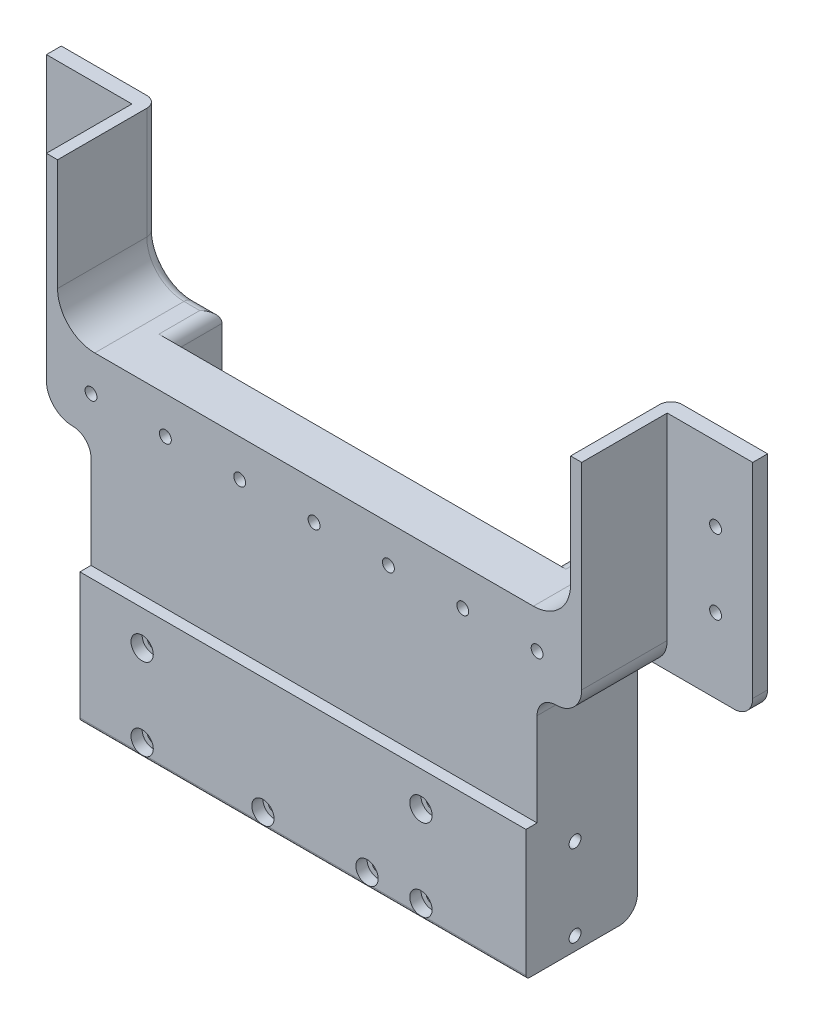
from build123d import *

# Parameters (mm, degrees)
SKETCH_1_W                  = 150
SKETCH_1_H                  = 20
EXTRUDE_1_DEPTH             = 20
SKETCH_2_W                  = 60
SKETCH_2_H                  = 65
EXTRUDE_2_DEPTH             = 5
SKETCH_3_R                  = 1.6
CUT_EXTRUDE_1_DEPTH         = 25
SKETCH_4_W                  = 51.75
SKETCH_4_H                  = 7
CUT_EXTRUDE_2_DEPTH         = 27
SKETCH_5_R                  = 1.6
CUT_EXTRUDE_3_DEPTH         = 27
SKETCH_6_W                  = 103.5
SKETCH_6_H                  = 35
EXTRUDE_3_DEPTH             = 8
SKETCH_7_W                  = 120
SKETCH_7_H                  = 35
SKETCH_7_R                  = 3
EXTRUDE_4_DEPTH             = 3
SKETCH_8_W                  = 23.25
SKETCH_8_H                  = 20
EXTRUDE_5_DEPTH             = 3
PATTERN_LINEAR_1_COUNT      = 5
PATTERN_LINEAR_1_PITCH      = 20
PATTERN_LINEAR_1_COUNT_DIR2 = 6
PATTERN_LINEAR_1_PITCH_DIR2 = 20
EXTRUDE_6_DEPTH             = 4
SKETCH_10_W                 = 3
SKETCH_10_H                 = 23
CUT_EXTRUDE_4_DEPTH         = 29
EXTRUDE_7_DEPTH             = 40
FILLET_1_R                  = 10
FILLET_2_R                  = 3
SKETCH_16_W                 = 22
SKETCH_16_H                 = 65
SKETCH_16_R                 = 1.6
EXTRUDE_9_DEPTH             = 8.25
EXTRUDE_START               = 8.25
SKETCH_17_W                 = 22
SKETCH_17_H                 = 65
SKETCH_17_R                 = 1.6
EXTRUDE_10_DEPTH            = 8.25
FILLET_4_R                  = 5
FILLET_5_R                  = 5
FILLET_6_R                  = 1
SKETCH_18_R                 = 3
CUT_EXTRUDE_6_DEPTH         = 5
FILLET_7_R                  = 5
FILLET_8_R                  = 7
SKETCH_19_R                 = 1.6
CUT_EXTRUDE_7_DEPTH         = 45


# Some blends are built 0.0001 mm under size
with BuildPart() as part:
    # 草图1 → 凸台-拉伸1 (new body)
    with BuildSketch(Plane(origin=(0, 0, 0), x_dir=(1, 0, 0), z_dir=(0, 1, 0))):
        Rectangle(SKETCH_1_W, SKETCH_1_H)
    extrude(amount=EXTRUDE_1_DEPTH)

    # 草图2 → 凸台-拉伸2 (add)
    with BuildSketch(Plane.XY.offset(10)):
        with Locations((-30, -32.5)):
            Rectangle(SKETCH_2_W, SKETCH_2_H)
        with Locations((30, -32.5)):
            Rectangle(SKETCH_2_W, SKETCH_2_H)
    extrude(amount=-EXTRUDE_2_DEPTH)

    # 草图3 → 切除-拉伸1 (cut)
    with BuildSketch(Plane(origin=(0, 0, -10), x_dir=(-1, 0, 0), z_dir=(0, 0, -1))):
        with Locations((0, 10)):
            Circle(SKETCH_3_R)
    cut_extrude_1 = extrude(amount=-CUT_EXTRUDE_1_DEPTH, mode=Mode.SUBTRACT)

    # 草图4 → 切除-拉伸2 (cut)
    with BuildSketch(Plane(origin=(0, 20, 0), x_dir=(1, 0, 0), z_dir=(0, 1, 0))):
        with Locations((-25.875, 6.5)):
            Rectangle(SKETCH_4_W, SKETCH_4_H)
        with Locations((25.875, 6.5)):
            Rectangle(SKETCH_4_W, SKETCH_4_H)
    extrude(amount=-CUT_EXTRUDE_2_DEPTH, mode=Mode.SUBTRACT)

    # 草图5 → 切除-拉伸3 (cut)
    with BuildSketch(Plane(origin=(0, 0, 5), x_dir=(-1, 0, 0), z_dir=(0, 0, -1))):
        with Locations((43.25, -61.370748044)):
            Circle(SKETCH_5_R)
        with Locations((43.25, -39.370748224)):
            Circle(SKETCH_5_R)
        with Locations((10.750003407, -61.370748044)):
            Circle(SKETCH_5_R)
        with Locations((-17.249996593, -61.370748044)):
            Circle(SKETCH_5_R)
        with Locations((-31.749999997, -61.370748044)):
            Circle(SKETCH_5_R)
        with Locations((-31.749999997, -39.370748224)):
            Circle(SKETCH_5_R)
    extrude(amount=-CUT_EXTRUDE_3_DEPTH, mode=Mode.SUBTRACT)

    # 草图6 → 凸台-拉伸3 (add)
    with BuildSketch(Plane(origin=(0, 0, 5), x_dir=(-1, 0, 0), z_dir=(0, 0, -1))):
        with Locations((0, -17.5)):
            Rectangle(SKETCH_6_W, SKETCH_6_H)
    extrude(amount=EXTRUDE_3_DEPTH)

    # 草图7 → 凸台-拉伸4 (add)
    with BuildSketch(Plane.XY.offset(10)):
        with Locations((0, -47.5)):
            Rectangle(SKETCH_7_W, SKETCH_7_H)
        with Locations((31.749999997, -39.370748224)):
            Circle(SKETCH_7_R, mode=Mode.SUBTRACT)
        with Locations((31.749999997, -61.370748044)):
            Circle(SKETCH_7_R, mode=Mode.SUBTRACT)
        with Locations((17.249996593, -61.370748044)):
            Circle(SKETCH_7_R, mode=Mode.SUBTRACT)
        with Locations((-10.750003407, -61.370748044)):
            Circle(SKETCH_7_R, mode=Mode.SUBTRACT)
        with Locations((-43.25, -39.370748224)):
            Circle(SKETCH_7_R, mode=Mode.SUBTRACT)
        with Locations((-43.25, -61.370748044)):
            Circle(SKETCH_7_R, mode=Mode.SUBTRACT)
    extrude(amount=EXTRUDE_4_DEPTH)

    # 草图8 → 凸台-拉伸5 (add)
    with BuildSketch(Plane(origin=(0, 0, -10), x_dir=(-1, 0, 0), z_dir=(0, 0, -1))):
        with Locations((63.375, 10)):
            Rectangle(SKETCH_8_W, SKETCH_8_H)
        with Locations((-63.375, 10)):
            Rectangle(SKETCH_8_W, SKETCH_8_H)
    extrude(amount=EXTRUDE_5_DEPTH)

    # 阵列(线性)1: Cut-Extrude 1 5 × 6
    with Locations(*[Vector(1, 0, 0) * (i * PATTERN_LINEAR_1_PITCH) + Vector(-1, 0, 0) * (j * PATTERN_LINEAR_1_PITCH_DIR2) for i in range(PATTERN_LINEAR_1_COUNT) for j in range(PATTERN_LINEAR_1_COUNT_DIR2) if (i, j) != (0, 0)]):
        add(cut_extrude_1, mode=Mode.SUBTRACT)

    # 草图9 → 凸台-拉伸6 (add)
    with BuildSketch(Plane(origin=(0, 0, -13), x_dir=(-1, 0, 0), z_dir=(0, 0, -1))):
        Polygon((-75, 0), (-95, 0), (-95, 60), (-75, 60), (-75, 20), (-51.75, 20), (-51.75, 0), align=None)
        Polygon((75, 0), (95, 0), (95, 60), (75, 60), (75, 20), (51.75, 20), (51.75, 0), align=None)
    extrude(amount=EXTRUDE_6_DEPTH)

    # 草图10 → 切除-拉伸4 (cut)
    with BuildSketch(Plane(origin=(0, 20, 0), x_dir=(1, 0, 0), z_dir=(0, 1, 0))):
        with Locations((-73.5, 1.5)):
            Rectangle(SKETCH_10_W, SKETCH_10_H)
        with Locations((73.5, 1.5)):
            Rectangle(SKETCH_10_W, SKETCH_10_H)
    extrude(amount=-CUT_EXTRUDE_4_DEPTH, mode=Mode.SUBTRACT)

    # 草图11 → 凸台-拉伸7 (add)
    with BuildSketch(Plane(origin=(0, 20, 0), x_dir=(1, 0, 0), z_dir=(0, 1, 0))):
        Polygon((-69, 17), (-75, 17), (-75, 13), (-72, 13), (-72, -10), (-69, -10), align=None)
        Polygon((69, 17), (69, -10), (72, -10), (72, 13), (75, 13), (75, 17), align=None)
    extrude(amount=EXTRUDE_7_DEPTH)

    # 圆角1
    fillet_1_edges = [part.edges().sort_by_distance(p)[0] for p in [
        (-69, 20, -3.5),
        (69, 20, -3.5),
    ]]
    fillet(fillet_1_edges, radius=FILLET_1_R)

    # 圆角2
    fillet_2_edges = [part.edges().sort_by_distance(p)[0] for p in [
        (55.375, 20, -17),
        (-69, 45, -17),
        (69, 45, -17),
        (-55.375, 20, -17),
        (66.071067812, 22.928932188, -17),
        (-66.071067812, 22.928932188, -17),
        (-51.75, 20, -10),
        (51.75, 20, -10),
    ]]
    fillet(fillet_2_edges, radius=FILLET_2_R)

    # 草图16 → 凸台-拉伸9 (add)
    with BuildSketch(Plane(origin=(51.75, 0, 0), x_dir=(0, 0, -1), z_dir=(1, 0, 0))):
        with Locations((6, -32.5)):
            Rectangle(SKETCH_16_W, SKETCH_16_H)
        with Locations(Location((0.2, -39.370754998, 0), (0, 0, 270))):
            Circle(SKETCH_16_R, mode=Mode.SUBTRACT)
        with Locations(Location((0.2, -61.370748044, 0), (0, 0, 270))):
            Circle(SKETCH_16_R, mode=Mode.SUBTRACT)
    extrude(amount=EXTRUDE_9_DEPTH)

    # 草图17 → 凸台-拉伸10 (add)
    with BuildSketch(Plane.ZY.offset(51.75).offset(EXTRUDE_START)):
        with Locations((-6, -32.5)):
            Rectangle(SKETCH_17_W, SKETCH_17_H)
        with Locations(Location((-0.2, -61.370748044, 0), (0, 0, 270))):
            Circle(SKETCH_17_R, mode=Mode.SUBTRACT)
        with Locations(Location((-0.2, -39.370748224, 0), (0, 0, 270))):
            Circle(SKETCH_17_R, mode=Mode.SUBTRACT)
    extrude(amount=-EXTRUDE_10_DEPTH)

    # 圆角4
    fillet_4_edges = [part.edges().sort_by_distance(p)[0] for p in [
        (-60, 0, -3.5),
        (60, 0, -3.5),
        (95, 0, -15),
        (-95, 0, -15),
    ]]
    fillet(fillet_4_edges, radius=FILLET_4_R)

    # 圆角5
    fillet_5_edges = [part.edges().sort_by_distance(p)[0] for p in [
        (55.875, -65, -17),
        (-55.875, -65, -17),
    ]]
    fillet(fillet_5_edges, radius=FILLET_5_R)

    # 圆角6
    # the kernel refuses this fillet: 1 mm, written as the material it takes off along each edge
    with BuildSketch(Plane(origin=(62.5, -65, 13), x_dir=(0, 0, -1), z_dir=(-1, 0, 0))) as fillet_6_piece_1:
        with BuildLine():
            CenterArc((FILLET_6_R, -FILLET_6_R), FILLET_6_R, 90, 90)
            Line((0, -FILLET_6_R), (0, 0))
            Line((0, 0), (FILLET_6_R, 0))
        make_face()
    extrude(amount=125, mode=Mode.SUBTRACT)

    # 草图18 → 切除-拉伸6 (cut)
    with BuildSketch(Plane(origin=(0, 0, -3), x_dir=(-1, 0, 0), z_dir=(0, 0, -1))):
        with Locations((0, 10)):
            Circle(SKETCH_18_R)
        with Locations((20, 10)):
            Circle(SKETCH_18_R)
        with Locations((40, 10)):
            Circle(SKETCH_18_R)
        with Locations((-20, 10)):
            Circle(SKETCH_18_R)
        with Locations((-40, 10)):
            Circle(SKETCH_18_R)
    extrude(amount=-CUT_EXTRUDE_6_DEPTH, mode=Mode.SUBTRACT)

    # 圆角7
    fillet_7_edges = [part.edges().sort_by_distance(p)[0] for p in [
        (0, -35, -3),
    ]]
    fillet(fillet_7_edges, radius=FILLET_7_R)

    # 圆角8
    fillet_8_edges = [part.edges().sort_by_distance(p)[0] for p in [
        (-72, 0, -1.5),
        (72, 0, -1.5),
    ]]
    fillet(fillet_8_edges, radius=FILLET_8_R - 0.0001)  # a hair under: the kernel refuses the full size

    # 草图19 → 切除-拉伸7 (cut)
    with BuildSketch(Plane.XY.offset(13)):
        with Locations((85, 39.999999445)):
            Circle(SKETCH_19_R)
        with Locations((85, 19.999999445)):
            Circle(SKETCH_19_R)
        with Locations((-85, 19.999999445)):
            Circle(SKETCH_19_R)
        with Locations((-85, 39.999999445)):
            Circle(SKETCH_19_R)
    extrude(amount=-CUT_EXTRUDE_7_DEPTH, mode=Mode.SUBTRACT)


solid = part.part
